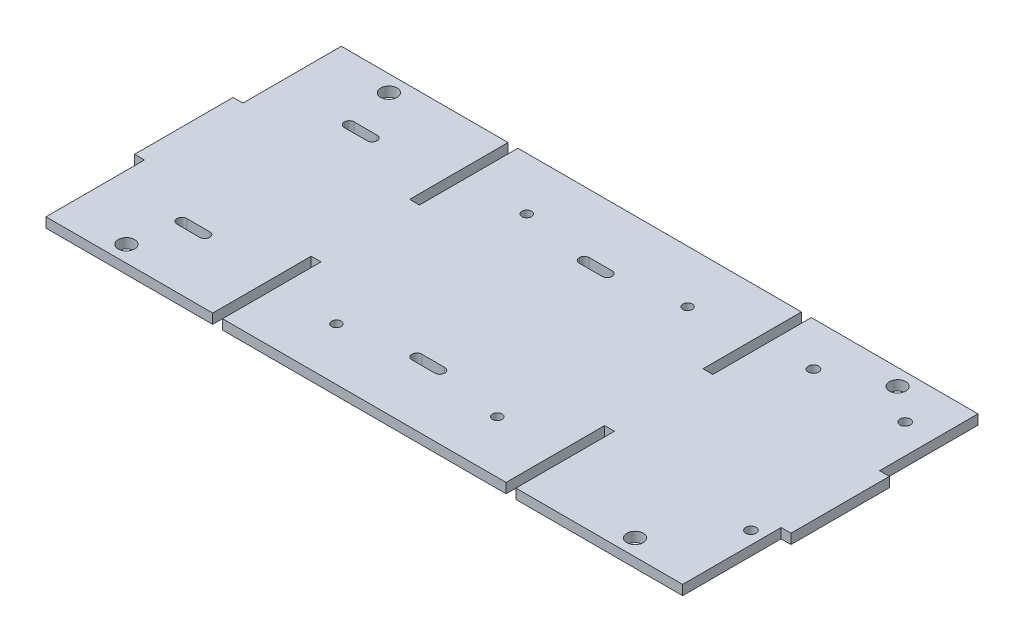
from build123d import *

# Parameters (mm, degrees)
SKETCH1_W           = 200
SKETCH1_H           = 90
BOSS_EXTRUDE1_DEPTH = 3
SKETCH2_W           = 3
SKETCH2_H           = 30
CUT_EXTRUDE1_DEPTH  = 110.69958979
SKETCH3_W           = 3
SKETCH3_H           = 30
CUT_EXTRUDE2_DEPTH  = 110.69958979
SKETCH4_R           = 1.45
SKETCH4_R_2         = 1.5875
SKETCH4_W           = 10
SKETCH4_H           = 3
CUT_EXTRUDE3_DEPTH  = 110.69958979
FILLET1_R           = 1.5
SKETCH5_R           = 2.5
CUT_EXTRUDE4_DEPTH  = 110.69958979


with BuildPart() as part:
    # Sketch1 → Boss-Extrude1 (new body)
    with BuildSketch(Plane(origin=(0, 0, 0), x_dir=(1, 0, 0), z_dir=(0, 1, 0))):
        Rectangle(SKETCH1_W, SKETCH1_H)
    extrude(amount=BOSS_EXTRUDE1_DEPTH)

    # Sketch2 → Cut-Extrude1 (cut, through all)
    with BuildSketch(Plane(origin=(0, 3, 0), x_dir=(1, 0, 0), z_dir=(0, 1, 0))):
        with Locations((-98.5, 30)):
            Rectangle(SKETCH2_W, SKETCH2_H)
        with Locations((-98.5, -30)):
            Rectangle(SKETCH2_W, SKETCH2_H)
    cut_extrude1 = extrude(amount=-CUT_EXTRUDE1_DEPTH, mode=Mode.SUBTRACT)

    # Mirror1: Cut-Extrude1 across plane
    add(cut_extrude1.mirror(Plane(origin=(0, 0, 0), x_dir=(0, 0, 1), z_dir=(1, 0, 0))), mode=Mode.SUBTRACT)

    # Sketch3 → Cut-Extrude2 (cut, through all)
    with BuildSketch(Plane(origin=(0, 3, 0), x_dir=(1, 0, 0), z_dir=(0, 1, 0))):
        with Locations((44.7, 30)):
            Rectangle(SKETCH3_W, SKETCH3_H)
        with Locations((44.7, -30)):
            Rectangle(SKETCH3_W, SKETCH3_H)
    cut_extrude2 = extrude(amount=-CUT_EXTRUDE2_DEPTH, mode=Mode.SUBTRACT)

    # Mirror2: Cut-Extrude2 across plane
    add(cut_extrude2.mirror(Plane(origin=(0, 0, 0), x_dir=(0, 0, 1), z_dir=(1, 0, 0))), mode=Mode.SUBTRACT)

    # Sketch4 → Cut-Extrude3 (cut, through all)
    with BuildSketch(Plane.XZ):
        with Locations(Location((-24.5, 29, 0), (0, 0, 270))):
            Circle(SKETCH4_R)
        with Locations(Location((24.5, 29, 0), (0, 0, 270))):
            Circle(SKETCH4_R)
        with Locations(Location((24.5, -29, 0), (0, 0, 270))):
            Circle(SKETCH4_R)
        with Locations(Location((-24.5, -29, 0), (0, 0, 270))):
            Circle(SKETCH4_R)
        with Locations(Location((93.13, 20.32, 0), (0, 0, 270))):
            Circle(SKETCH4_R_2)
        with Locations(Location((60.11, -31.75, 0), (0, 0, 270))):
            Circle(SKETCH4_R_2)
        with Locations(Location((88.05, -31.75, 0), (0, 0, 270))):
            Circle(SKETCH4_R_2)
        with Locations((0, 25.5)):
            Rectangle(SKETCH4_W, SKETCH4_H)
        with Locations((0, -25.5)):
            Rectangle(SKETCH4_W, SKETCH4_H)
        with Locations((-71.6, 25.5)):
            Rectangle(SKETCH4_W, SKETCH4_H)
        with Locations((-71.6, -25.5)):
            Rectangle(SKETCH4_W, SKETCH4_H)
    extrude(amount=-CUT_EXTRUDE3_DEPTH, mode=Mode.SUBTRACT)

    # Fillet1
    fillet1_edges = [part.edges().sort_by_distance(p)[0] for p in [
        (-5, 1.5, -27),
        (-5, 1.5, -24),
        (5, 1.5, -24),
        (5, 1.5, -27),
        (-5, 1.5, 24),
        (-5, 1.5, 27),
        (5, 1.5, 27),
        (5, 1.5, 24),
        (-76.6, 1.5, 24),
        (-76.6, 1.5, 27),
        (-66.6, 1.5, 27),
        (-66.6, 1.5, -24),
        (-66.6, 1.5, -27),
        (-76.6, 1.5, -27),
        (-76.6, 1.5, -24),
        (-66.6, 1.5, 24),
    ]]
    fillet(fillet1_edges, radius=FILLET1_R - 0.0001)  # a hair under: the kernel refuses the full size

    # Sketch5 → Cut-Extrude4 (cut, through all)
    with BuildSketch(Plane(origin=(0, 3, 0), x_dir=(1, 0, 0), z_dir=(0, 1, 0))):
        with Locations(Location((-77.5, 40, 0), (0, 0, 270))):
            Circle(SKETCH5_R)
        with Locations(Location((77.5, 40, 0), (0, 0, 270))):
            Circle(SKETCH5_R)
        with Locations(Location((77.5, -40, 0), (0, 0, 270))):
            Circle(SKETCH5_R)
        with Locations(Location((-77.5, -40, 0), (0, 0, 270))):
            Circle(SKETCH5_R)
    extrude(amount=-CUT_EXTRUDE4_DEPTH, mode=Mode.SUBTRACT)


solid = part.part
